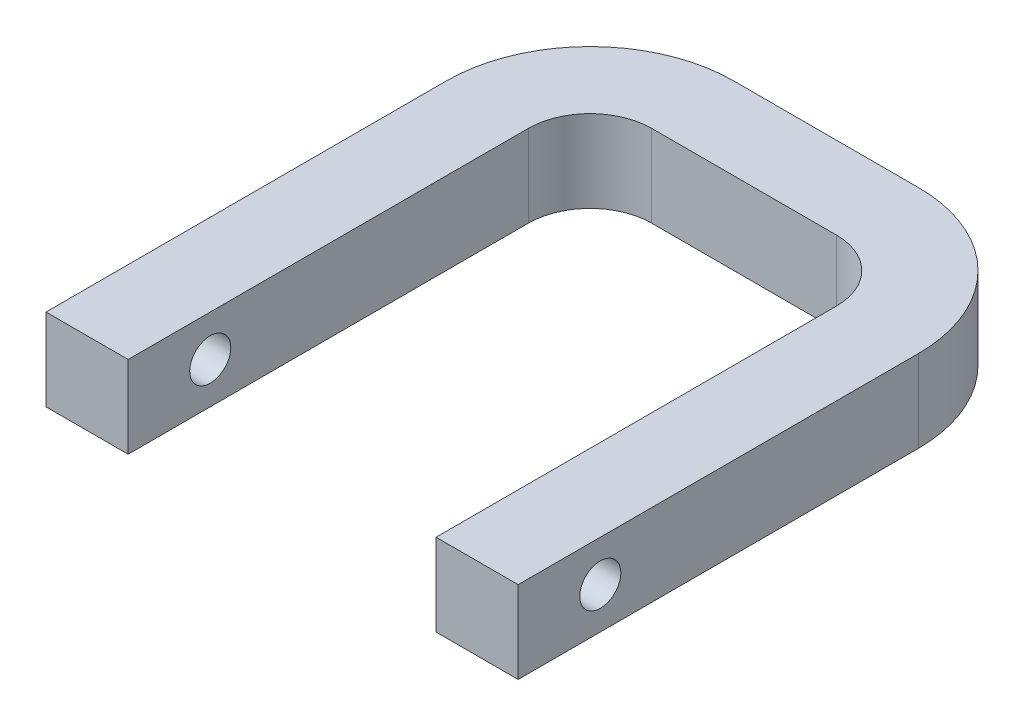
from build123d import *

# Parameters (mm, degrees)
BOSS_EXTRUDE1_DEPTH      = 4
BOSS_EXTRUDE1_DEPTH_BACK = 4
CUT_EXTRUDE1_DEPTH       = 66.337584896
CUT_EXTRUDE1_DEPTH_BACK  = 66.337584896
SKETCH2_R                = 2


with BuildPart() as part:
    # Sketch1 → Boss-Extrude1 (new, two sides: drawn at the far end of the back side and taken through both)
    with BuildSketch(Plane(origin=(0, 0, 0), x_dir=(1, 0, 0), z_dir=(0, 1, 0)).offset(-BOSS_EXTRUDE1_DEPTH_BACK)):
        with BuildLine():
            Line((-9, 0), (9, 0))
            ThreePointArc((9, 0), (18.899494937, -4.100505063), (23, -14))
            Line((23, -14), (23, -53))
            Line((23, -53), (15, -53))
            Line((15, -53), (15, -14))
            ThreePointArc((15, -14), (13.242640687, -9.757359313), (9, -8))
            Line((9, -8), (-9, -8))
            ThreePointArc((-9, -8), (-13.242640687, -9.757359313), (-15, -14))
            Line((-15, -14), (-15, -53))
            Line((-15, -53), (-23, -53))
            Line((-23, -53), (-23, -14))
            ThreePointArc((-23, -14), (-18.899494937, -4.100505063), (-9, 0))
        make_face()
    extrude(amount=BOSS_EXTRUDE1_DEPTH + BOSS_EXTRUDE1_DEPTH_BACK)

    # Sketch2 → Cut-Extrude1 (cut, two sides: drawn at the far end of the back side and taken through both)
    with BuildSketch(Plane.ZY.offset(-15).offset(-CUT_EXTRUDE1_DEPTH_BACK)):
        with Locations((45, 0)):
            Circle(SKETCH2_R)
    extrude(amount=CUT_EXTRUDE1_DEPTH + CUT_EXTRUDE1_DEPTH_BACK, mode=Mode.SUBTRACT)


solid = part.part
